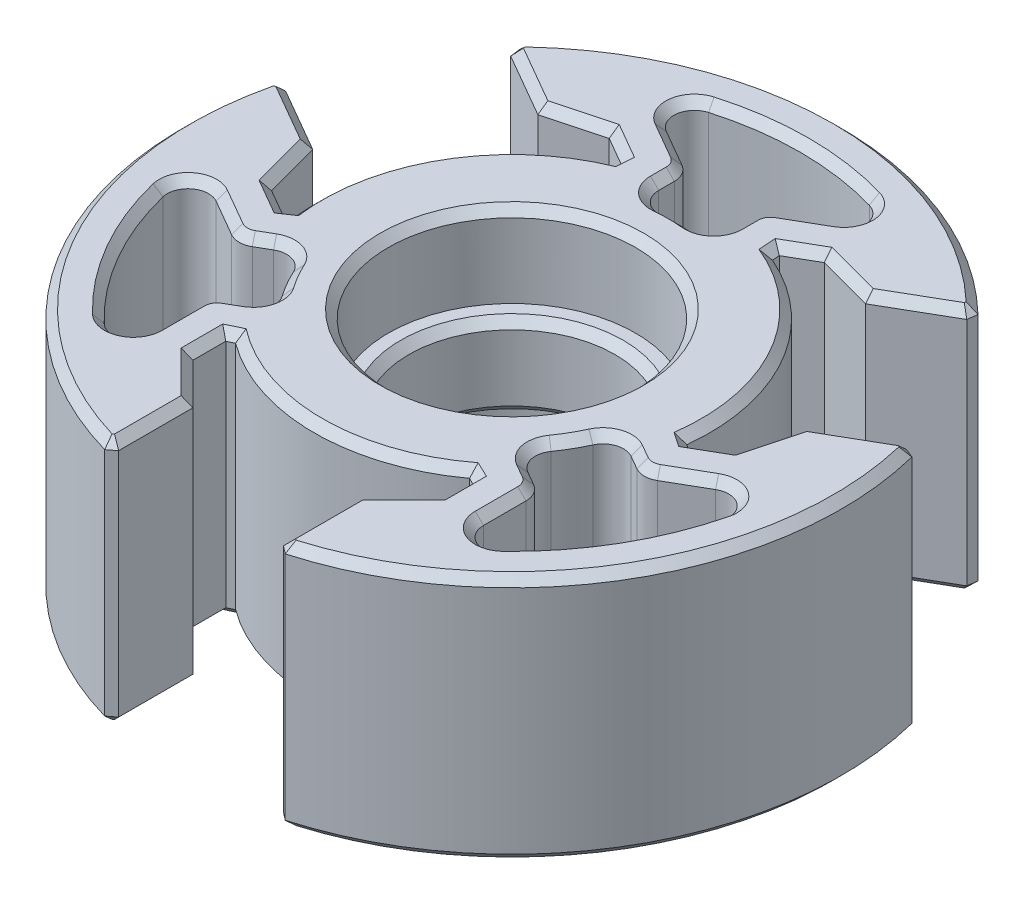
from build123d import *

# Parameters (mm, degrees)
STOCK_LOWER_CARRIAGE_MASTER_1_START = 35
STOCK_LOWER_CARRIAGE_MASTER_1_DEPTH = 12
CUT_EXTRUDE1_DEPTH                  = 26.61249695
FILLET1_R                           = 1
CIRPATTERN1_COUNT                   = 3
FILLET1_OF_CIRPATTERN1_R            = 1
CHAMFER1_SIZE                       = 0.4


# Read off the part's stored shape, not the designer's step: Stock-lower_carriage_master-1
with BuildPart() as part:
    # Stock-lower_carriage_master-1 outline → Stock-lower_carriage_master-1 (new body)
    with BuildSketch(Plane(origin=(0, 0, 0), x_dir=(1, 0, 0), z_dir=(0, 1, 0)).offset(STOCK_LOWER_CARRIAGE_MASTER_1_START)):
        with BuildLine():
            Line((-15.069997703, 4.081865077), (-15.517710218, 3.898803609))
            ThreePointArc((-15.517710218, 3.898803609), (-13.856406461, -8), (-4.382392139, -15.388133062))
            Line((-4.382392139, -15.388133062), (-4, -15.091933385))
            Line((-4, -15.091933385), (-4, -11.491933385))
            Line((-4, -11.491933385), (-6, -9.491933385))
            Line((-6, -9.491933385), (-6, -7.891933385))
            Line((-6, -7.891933385), (-5.679274001, -7.737888127))
            ThreePointArc((-5.679274001, -7.737888127), (0, -9.598388711), (5.679274001, -7.737888127))
            Line((5.679274001, -7.737888127), (6, -7.891933385))
            Line((6, -7.891933385), (6, -9.491933385))
            Line((6, -9.491933385), (4, -11.491933385))
            Line((4, -11.491933385), (4, -15.091933385))
            Line((4, -15.091933385), (4.382392139, -15.388133062))
            ThreePointArc((4.382392139, -15.388133062), (13.856406461, -8), (15.517710218, 3.898803609))
            Line((15.517710218, 3.898803609), (15.069997703, 4.081865077))
            Line((15.069997703, 4.081865077), (11.95230625, 2.281865077))
            Line((11.95230625, 2.281865077), (11.220255442, -0.45018573))
            Line((11.220255442, -0.45018573), (9.834614796, -1.25018573))
            Line((9.834614796, -1.25018573), (9.54084469, -1.049451497))
            ThreePointArc((9.54084469, -1.049451497), (8.312448459, 4.799194355), (3.861570689, 8.787339624))
            Line((3.861570689, 8.787339624), (3.834614796, 9.142119115))
            Line((3.834614796, 9.142119115), (5.220255442, 9.942119115))
            Line((5.220255442, 9.942119115), (7.95230625, 9.210068308))
            Line((7.95230625, 9.210068308), (11.069997703, 11.010068308))
            Line((11.069997703, 11.010068308), (11.135318079, 11.489329453))
            ThreePointArc((11.135318079, 11.489329453), (0, 16), (-11.135318079, 11.489329453))
            Line((-11.135318079, 11.489329453), (-11.069997703, 11.010068308))
            Line((-11.069997703, 11.010068308), (-7.95230625, 9.210068308))
            Line((-7.95230625, 9.210068308), (-5.220255442, 9.942119115))
            Line((-5.220255442, 9.942119115), (-3.834614796, 9.142119115))
            Line((-3.834614796, 9.142119115), (-3.861570689, 8.787339624))
            ThreePointArc((-3.861570689, 8.787339624), (-8.312448459, 4.799194355), (-9.54084469, -1.049451497))
            Line((-9.54084469, -1.049451497), (-9.834614796, -1.25018573))
            Line((-9.834614796, -1.25018573), (-11.220255442, -0.45018573))
            Line((-11.220255442, -0.45018573), (-11.95230625, 2.281865077))
            Line((-11.95230625, 2.281865077), (-15.069997703, 4.081865077))
        make_face()
    extrude(amount=STOCK_LOWER_CARRIAGE_MASTER_1_DEPTH)

    # Sketch1 → Cut-Revolve1 (revolve, cut)
    with BuildSketch(Plane(origin=(0, 0, 0), x_dir=(0, 0, -1), z_dir=(1, 0, 0)), mode=Mode.PRIVATE) as cut_revolve1_sk:
        Polygon((0, 47), (6, 47), (6, 43), (5, 43), (5, 39), (6, 39), (6, 35), (0, 35), align=None)
    revolve(cut_revolve1_sk.sketch.rotate(Axis((0, 71.373766779, 0), (0, -1, 0)), 180), axis=Axis((0, 71.373766779, 0), (0, -1, 0)), mode=Mode.SUBTRACT)

    # Sketch2 → Cut-Extrude1 (cut, through all)
    with BuildSketch(Plane(origin=(0, 47, 0), x_dir=(1, 0, 0), z_dir=(0, 1, 0))):
        with BuildLine():
            Line((-5.949874371, 12.672765877), (-1.834614796, 10.296819654))
            Line((-1.834614796, 10.296819654), (-1.834614796, 7.786795782))
            ThreePointArc((-1.834614796, 7.786795782), (0, 8), (1.834614796, 7.786795782))
            Line((1.834614796, 7.786795782), (1.834614796, 10.296819654))
            Line((1.834614796, 10.296819654), (5.949874371, 12.672765877))
            ThreePointArc((5.949874371, 12.672765877), (0, 14), (-5.949874371, 12.672765877))
        make_face()
    cut_extrude1 = extrude(amount=-CUT_EXTRUDE1_DEPTH, mode=Mode.SUBTRACT)

    # Fillet1
    fillet1_edges = [part.edges().sort_by_distance(p)[0] for p in [
        (-5.949874371, 41, -12.672765877),
        (5.949874371, 41, -12.672765877),
        (1.834614796, 41, -10.296819654),
        (1.834614796, 41, -7.786795782),
        (-1.834614796, 41, -7.786795782),
        (-1.834614796, 41, -10.296819654),
    ]]
    fillet(fillet1_edges, radius=FILLET1_R)

    # CirPattern1: Cut-Extrude1 ×3 about axis
    cirpattern1_axis = Axis((0, 0, 0), (0, 1, 0))
    for i in range(1, CIRPATTERN1_COUNT):
        add(cut_extrude1.rotate(cirpattern1_axis, i * 360 / CIRPATTERN1_COUNT), mode=Mode.SUBTRACT)

    # Fillet1 of CirPattern1
    fillet1_of_cirpattern1_edges = [part.edges().sort_by_distance(p)[0] for p in [
        (-8, 41, 11.489125293),
        (-13.949874371, 41, 1.183640584),
        (-9.834614796, 41, 3.559586807),
        (-7.660870359, 41, 2.304574871),
        (-5.826255563, 41, 5.482220911),
        (-8, 41, 6.737232846),
        (13.949874371, 41, 1.183640584),
        (8, 41, 11.489125293),
        (8, 41, 6.737232846),
        (5.826255563, 41, 5.482220911),
        (7.660870359, 41, 2.304574871),
        (9.834614796, 41, 3.559586807),
    ]]
    fillet(fillet1_of_cirpattern1_edges, radius=FILLET1_OF_CIRPATTERN1_R)

    # Chamfer1
    chamfer1_edges = [part.edges().sort_by_distance(p)[0] for p in [
        (4.527435119, 35, -9.542119115),
        (6.586280846, 35, -9.576093712),
        (9.511151977, 47, -10.110068308),
        (13.511151976, 35, -3.181865077),
        (11.586280846, 35, -0.915839674),
        (9.511151977, 35, -10.110068308),
        (11.586280846, 47, -0.915839674),
        (13.511151976, 47, -3.181865077),
        (6.586280846, 47, -9.576093712),
        (4.527435119, 47, -9.542119115),
        (-6, 35, 8.691933385),
        (-5, 35, 10.491933385),
        (5, 35, 10.491933385),
        (-13.856406461, 47, 8),
        (-4.527435119, 47, -9.542119115),
        (-8.312448459, 47, -4.799194355),
        (-15.29385396, 47, -3.990334343),
        (-11.102657891, 47, -11.24969888),
        (-13.856406461, 35, 8),
        (-8.312448459, 35, -4.799194355),
        (-4.527435119, 35, -9.542119115),
        (-15.29385396, 35, -3.990334343),
        (-11.102657891, 35, -11.24969888),
        (-9.687729743, 47, 1.149818613),
        (-9.687729743, 35, 1.149818613),
        (-3.848092742, 47, -8.964729369),
        (-3.848092742, 35, -8.964729369),
        (0, 47, -16),
        (10.527435119, 47, 0.85018573),
        (8.312448459, 47, -4.799194355),
        (11.102657891, 47, -11.24969888),
        (15.29385396, 47, -3.990334343),
        (0, 35, -16),
        (8.312448459, 35, -4.799194355),
        (10.527435119, 35, 0.85018573),
        (11.102657891, 35, -11.24969888),
        (15.29385396, 35, -3.990334343),
        (3.848092742, 47, -8.964729369),
        (3.848092742, 35, -8.964729369),
        (9.687729743, 47, 1.149818613),
        (9.687729743, 35, 1.149818613),
        (0, 47, -6),
        (0, 43, -5),
        (0, 39, -5),
        (0, 35, -6),
        (4, 47, 13.291933385),
        (-5, 47, 10.491933385),
        (-4, 47, 13.291933385),
        (5, 47, 10.491933385),
        (-3.2293266, 47, -11.102056889),
        (6, 47, 8.691933385),
        (-3.2293266, 35, -11.102056889),
        (0, 47, -14),
        (0, 35, -14),
        (3.2293266, 47, -11.102056889),
        (3.2293266, 35, -11.102056889),
        (1.834614796, 47, -9.340343416),
        (0, 47, -8),
        (-1.834614796, 47, -9.340343416),
        (-1.968589392, 47, -10.219469384),
        (1.968589392, 47, -10.219469384),
        (1.834614796, 35, -9.340343416),
        (-1.834614796, 35, -9.340343416),
        (0, 35, -8),
        (-1.968589392, 35, -10.219469384),
        (1.968589392, 35, -10.219469384),
        (-4.616782047, 47, -12.604894389),
        (-4.616782047, 35, -12.604894389),
        (4.616782047, 47, -12.604894389),
        (4.616782047, 35, -12.604894389),
        (1.508137262, 47, -8.222050695),
        (1.508137262, 35, -8.222050695),
        (-1.508137262, 47, -8.222050695),
        (-1.508137262, 35, -8.222050695),
        (-8, 47, 8.347707318),
        (-8, 35, 8.347707318),
        (-12.124355653, 47, 7),
        (-12.124355653, 35, 7),
        (-11.2293266, 47, 2.754349571),
        (-11.2293266, 35, 2.754349571),
        (-9.006282076, 47, 3.081348688),
        (-6.92820323, 47, 4),
        (-7.17166728, 47, 6.258994728),
        (-7.866025404, 47, 6.814583116),
        (-9.834614796, 47, 3.404886269),
        (-9.006282076, 35, 3.081348688),
        (-7.17166728, 35, 6.258994728),
        (-6.92820323, 35, 4),
        (-7.866025404, 35, 6.814583116),
        (-9.834614796, 35, 3.404886269),
        (-8.60776773, 47, 10.300697731),
        (-8.60776773, 35, 10.300697731),
        (-13.224549776, 47, 2.304196658),
        (-13.224549776, 35, 2.304196658),
        (-7.874573403, 47, 2.804940166),
        (-7.874573403, 35, 2.804940166),
        (-6.366436142, 47, 5.417110528),
        (-6.366436142, 35, 5.417110528),
        (11.2293266, 47, 2.754349571),
        (11.2293266, 35, 2.754349571),
        (12.124355653, 47, 7),
        (12.124355653, 35, 7),
        (8, 47, 8.347707318),
        (8, 35, 8.347707318),
        (7.17166728, 47, 6.258994728),
        (6.92820323, 47, 4),
        (9.006282076, 47, 3.081348688),
        (9.834614796, 47, 3.404886269),
        (7.866025404, 47, 6.814583116),
        (7.17166728, 35, 6.258994728),
        (9.006282076, 35, 3.081348688),
        (6.92820323, 35, 4),
        (9.834614796, 35, 3.404886269),
        (7.866025404, 35, 6.814583116),
        (13.224549776, 47, 2.304196658),
        (13.224549776, 35, 2.304196658),
        (8.60776773, 47, 10.300697731),
        (8.60776773, 35, 10.300697731),
        (6.366436142, 47, 5.417110528),
        (6.366436142, 35, 5.417110528),
        (7.874573403, 47, 2.804940166),
        (7.874573403, 35, 2.804940166),
        (13.856406461, 47, 8),
        (13.856406461, 35, 8),
        (-6, 47, 8.691933385),
        (0, 47, 9.598388711),
        (4.19119607, 47, 15.240033223),
        (-4.19119607, 47, 15.240033223),
        (-4, 35, 13.291933385),
        (4, 35, 13.291933385),
        (6, 35, 8.691933385),
        (0, 35, 9.598388711),
        (4.19119607, 35, 15.240033223),
        (-4.19119607, 35, 15.240033223),
        (5.839637, 47, 7.814910756),
        (5.839637, 35, 7.814910756),
        (-5.839637, 47, 7.814910756),
        (-5.839637, 35, 7.814910756),
        (-10.527435119, 35, 0.85018573),
        (-11.586280846, 35, -0.915839673),
        (-13.511151976, 47, -3.181865077),
        (-9.511151977, 35, -10.110068308),
        (-6.586280846, 35, -9.576093712),
        (-13.511151976, 35, -3.181865077),
        (-6.586280846, 47, -9.576093712),
        (-9.511151977, 47, -10.110068308),
        (-11.586280846, 47, -0.915839673),
        (-10.527435119, 47, 0.85018573),
    ]]
    chamfer(chamfer1_edges, length=CHAMFER1_SIZE)


solid = part.part
